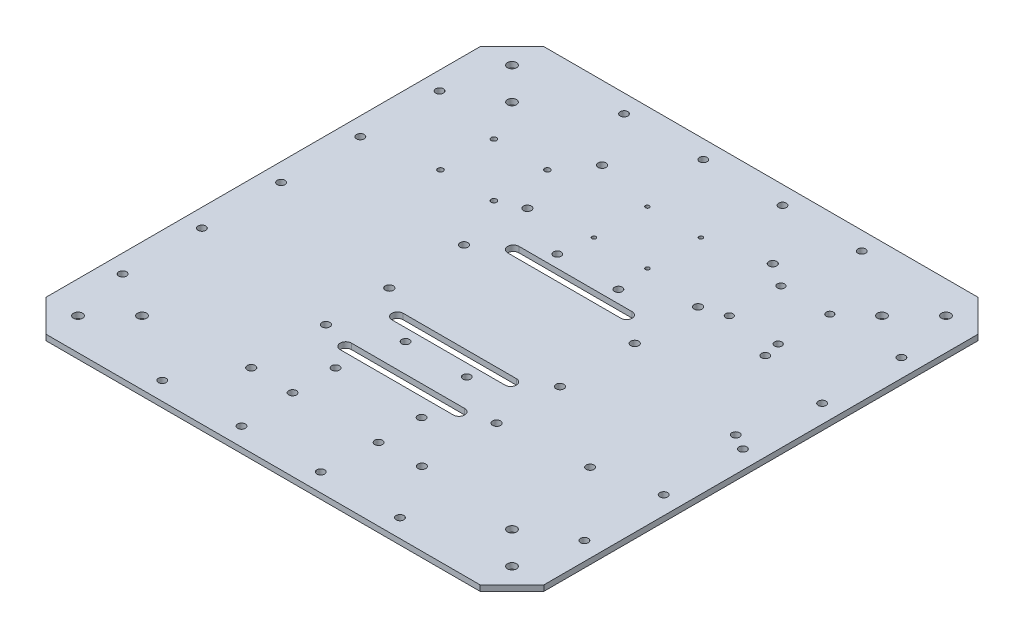
from build123d import *

# Parameters (mm, degrees)
BOSS_EXTRUDE1_DEPTH = 3.175
SKETCH2_R           = 2.159
CUT_EXTRUDE1_DEPTH  = 257.37661277
CUT_EXTRUDE2_DEPTH  = 257.37661277
SKETCH7_R           = 1.524
CUT_EXTRUDE3_DEPTH  = 257.37661277
SKETCH10_R          = 2.159
CUT_EXTRUDE6_DEPTH  = 257.37661277
SKETCH9_R           = 2.032
CUT_EXTRUDE5_DEPTH  = 257.37661277
SKETCH13_R          = 1.1
CUT_EXTRUDE8_DEPTH  = 257.37661277
SKETCH14_R          = 2.54
CUT_EXTRUDE9_DEPTH  = 257.37661277
SKETCH15_R          = 2.159
CUT_EXTRUDE10_DEPTH = 257.37661277
SKETCH16_R          = 2.159
CUT_EXTRUDE11_DEPTH = 257.37661277
SKETCH17_R          = 2.2225
CUT_EXTRUDE13_DEPTH = 257.37661277


with BuildPart() as part:
    # Sketch1 → Boss-Extrude1 (new body)
    with BuildSketch(Plane(origin=(0, 0, 0), x_dir=(1, 0, 0), z_dir=(0, 1, 0))):
        Polygon((-142.524216069, 79.491173458), (-160.484728311, 61.530661216), (-160.484728311, -181.9483143), (-142.524216069, -199.908826542), (100.954759447, -199.908826542), (118.915271689, -181.9483143), (118.915271689, 61.530661216), (100.954759447, 79.491173458), align=None)
    extrude(amount=BOSS_EXTRUDE1_DEPTH)

    # Sketch2 → Cut-Extrude1 (cut, through all)
    with BuildSketch(Plane(origin=(0, 3.175, 0), x_dir=(1, 0, 0), z_dir=(0, 1, 0))):
        with Locations((-38.056728311, -17.536826542)):
            Circle(SKETCH2_R)
        with Locations((-3.766728311, -17.536826542)):
            Circle(SKETCH2_R)
        with Locations((-38.056728311, -102.626826542)):
            Circle(SKETCH2_R)
        with Locations((-3.766728311, -102.626826542)):
            Circle(SKETCH2_R)
    extrude(amount=-CUT_EXTRUDE1_DEPTH, mode=Mode.SUBTRACT)

    # Sketch4 → Cut-Extrude2 (cut, through all)
    with BuildSketch(Plane(origin=(0, 3.175, 0), x_dir=(1, 0, 0), z_dir=(0, 1, 0))):
        with BuildLine():
            Line((-52.534728311, -24.533826542), (10.965271689, -24.533826542))
            ThreePointArc((10.965271689, -24.533826542), (14.140271689, -27.708826542), (10.965271689, -30.883826542))
            Line((10.965271689, -30.883826542), (-52.534728311, -30.883826542))
            ThreePointArc((-52.534728311, -30.883826542), (-55.709728311, -27.708826542), (-52.534728311, -24.533826542))
        make_face()
        with BuildLine():
            Line((-52.534728311, -89.533826542), (10.965271689, -89.533826542))
            ThreePointArc((10.965271689, -89.533826542), (14.140271689, -92.708826542), (10.965271689, -95.883826542))
            Line((10.965271689, -95.883826542), (-52.534728311, -95.883826542))
            ThreePointArc((-52.534728311, -95.883826542), (-55.709728311, -92.708826542), (-52.534728311, -89.533826542))
        make_face()
        with BuildLine():
            Line((-52.534728311, -118.533006542), (10.965271689, -118.533006542))
            ThreePointArc((10.965271689, -118.533006542), (14.140271689, -121.708006542), (10.965271689, -124.883006542))
            Line((10.965271689, -124.883006542), (-52.534728311, -124.883006542))
            ThreePointArc((-52.534728311, -124.883006542), (-55.709728311, -121.708006542), (-52.534728311, -118.533006542))
        make_face()
    extrude(amount=-CUT_EXTRUDE2_DEPTH, mode=Mode.SUBTRACT)

    # Sketch7 → Cut-Extrude3 (cut, through all)
    with BuildSketch(Plane(origin=(0, 3.175, 0), x_dir=(1, 0, 0), z_dir=(0, 1, 0))):
        with Locations((-81.744728311, 20.563173458)):
            Circle(SKETCH7_R)
        with Locations((-81.744728311, -9.408826542)):
            Circle(SKETCH7_R)
        with Locations((-111.716728311, -9.408826542)):
            Circle(SKETCH7_R)
        with Locations((-111.716728311, 20.563173458)):
            Circle(SKETCH7_R)
    extrude(amount=-CUT_EXTRUDE3_DEPTH, mode=Mode.SUBTRACT)

    # Sketch10 → Cut-Extrude6 (cut, through all)
    with BuildSketch(Plane.XZ):
        with Locations((-44.914728311, 159.173006542)):
            Circle(SKETCH10_R)
        with Locations((3.345271689, 159.173006542)):
            Circle(SKETCH10_R)
        with Locations((-44.914728311, 135.043006542)):
            Circle(SKETCH10_R)
        with Locations((3.345271689, 135.043006542)):
            Circle(SKETCH10_R)
    extrude(amount=-CUT_EXTRUDE6_DEPTH, mode=Mode.SUBTRACT)

    # Sketch9 → Cut-Extrude5 (cut, through all)
    with BuildSketch(Plane(origin=(0, 0, 0), x_dir=(-1, 0, 0), z_dir=(0, -1, 0))):
        with Locations((-40.175271689, 0.751173458)):
            Circle(SKETCH9_R)
        with Locations((-67.607271689, 0.751173458)):
            Circle(SKETCH9_R)
        with Locations((-40.175271689, 29.707173458)):
            Circle(SKETCH9_R)
        with Locations((-67.607271689, 29.707173458)):
            Circle(SKETCH9_R)
    extrude(amount=-CUT_EXTRUDE5_DEPTH, mode=Mode.SUBTRACT)

    # Sketch13 → Cut-Extrude8 (cut, through all)
    with BuildSketch(Plane.XZ):
        with Locations((-35.784728311, -0.751173458)):
            Circle(SKETCH13_R)
        with Locations((-35.784728311, -30.751173458)):
            Circle(SKETCH13_R)
        with Locations((-5.784728311, -30.751173458)):
            Circle(SKETCH13_R)
        with Locations((-5.784728311, -0.751173458)):
            Circle(SKETCH13_R)
    extrude(amount=-CUT_EXTRUDE8_DEPTH, mode=Mode.SUBTRACT)

    # Sketch14 → Cut-Extrude9 (cut, through all)
    with BuildSketch(Plane.XZ):
        with Locations((-142.524216069, 181.9483143)):
            Circle(SKETCH14_R)
        with Locations((-124.563703827, 163.987802058)):
            Circle(SKETCH14_R)
        with Locations((82.994247204, 163.987802058)):
            Circle(SKETCH14_R)
        with Locations((100.954759447, 181.9483143)):
            Circle(SKETCH14_R)
        with Locations((-142.524216069, -61.530661216)):
            Circle(SKETCH14_R)
        with Locations((-124.563703827, -43.570148974)):
            Circle(SKETCH14_R)
        with Locations((100.954759447, -61.530661216)):
            Circle(SKETCH14_R)
        with Locations((82.994247204, -43.570148974)):
            Circle(SKETCH14_R)
    extrude(amount=-CUT_EXTRUDE9_DEPTH, mode=Mode.SUBTRACT)

    # Sketch15 → Cut-Extrude10 (cut, through all)
    with BuildSketch(Plane.XZ):
        with Locations((-43.009728311, 189.748826542)):
            Circle(SKETCH15_R)
        with Locations((-87.459728311, 189.748826542)):
            Circle(SKETCH15_R)
        with Locations((-150.324728311, 60.208826542)):
            Circle(SKETCH15_R)
        with Locations((-150.324728311, 104.658826542)):
            Circle(SKETCH15_R)
        with Locations((-150.324728311, 149.108826542)):
            Circle(SKETCH15_R)
        with Locations((108.755271689, 149.108826542)):
            Circle(SKETCH15_R)
        with Locations((108.755271689, 104.658826542)):
            Circle(SKETCH15_R)
        with Locations((108.755271689, 60.208826542)):
            Circle(SKETCH15_R)
        with Locations((45.890271689, 189.748826542)):
            Circle(SKETCH15_R)
        with Locations((1.440271689, 189.748826542)):
            Circle(SKETCH15_R)
        with Locations((1.440271689, -69.331173458)):
            Circle(SKETCH15_R)
        with Locations((45.890271689, -69.331173458)):
            Circle(SKETCH15_R)
        with Locations((108.755271689, 15.758826542)):
            Circle(SKETCH15_R)
        with Locations((108.755271689, -28.691173458)):
            Circle(SKETCH15_R)
        with Locations((-150.324728311, -28.691173458)):
            Circle(SKETCH15_R)
        with Locations((-150.324728311, 15.758826542)):
            Circle(SKETCH15_R)
        with Locations((-87.459728311, -69.331173458)):
            Circle(SKETCH15_R)
        with Locations((-43.009728311, -69.331173458)):
            Circle(SKETCH15_R)
    extrude(amount=-CUT_EXTRUDE10_DEPTH, mode=Mode.SUBTRACT)

    # Sketch16 → Cut-Extrude11 (cut, through all)
    with BuildSketch(Plane(origin=(0, 0, 0), x_dir=(-1, 0, 0), z_dir=(0, -1, 0))):
        with Locations((-74.719271689, -111.897826542)):
            Circle(SKETCH16_R)
        with Locations((-69.639271689, -8.519826542)):
            Circle(SKETCH16_R)
        with Locations((-99.865271689, -55.341826542)):
            Circle(SKETCH16_R)
    extrude(amount=-CUT_EXTRUDE11_DEPTH, mode=Mode.SUBTRACT)

    # Sketch17 → Cut-Extrude13 (cut, through all)
    with BuildSketch(Plane(origin=(0, 3.175, 0), x_dir=(1, 0, 0), z_dir=(0, 1, 0))):
        with Locations((27.094271689, -158.633826542)):
            Circle(SKETCH17_R)
        with Locations((-68.663728311, -158.633826542)):
            Circle(SKETCH17_R)
        with Locations((27.094271689, -116.723826542)):
            Circle(SKETCH17_R)
        with Locations((-68.663728311, -116.723826542)):
            Circle(SKETCH17_R)
        with Locations((27.094271689, -81.163826542)):
            Circle(SKETCH17_R)
        with Locations((-68.663728311, -81.163826542)):
            Circle(SKETCH17_R)
        with Locations((27.094271689, -39.253826542)):
            Circle(SKETCH17_R)
        with Locations((-68.663728311, -39.253826542)):
            Circle(SKETCH17_R)
        with Locations((27.094271689, -3.693826542)):
            Circle(SKETCH17_R)
        with Locations((-68.663728311, -3.693826542)):
            Circle(SKETCH17_R)
        with Locations((27.094271689, 38.216173458)):
            Circle(SKETCH17_R)
        with Locations((-68.663728311, 38.216173458)):
            Circle(SKETCH17_R)
    extrude(amount=-CUT_EXTRUDE13_DEPTH, mode=Mode.SUBTRACT)


solid = part.part
